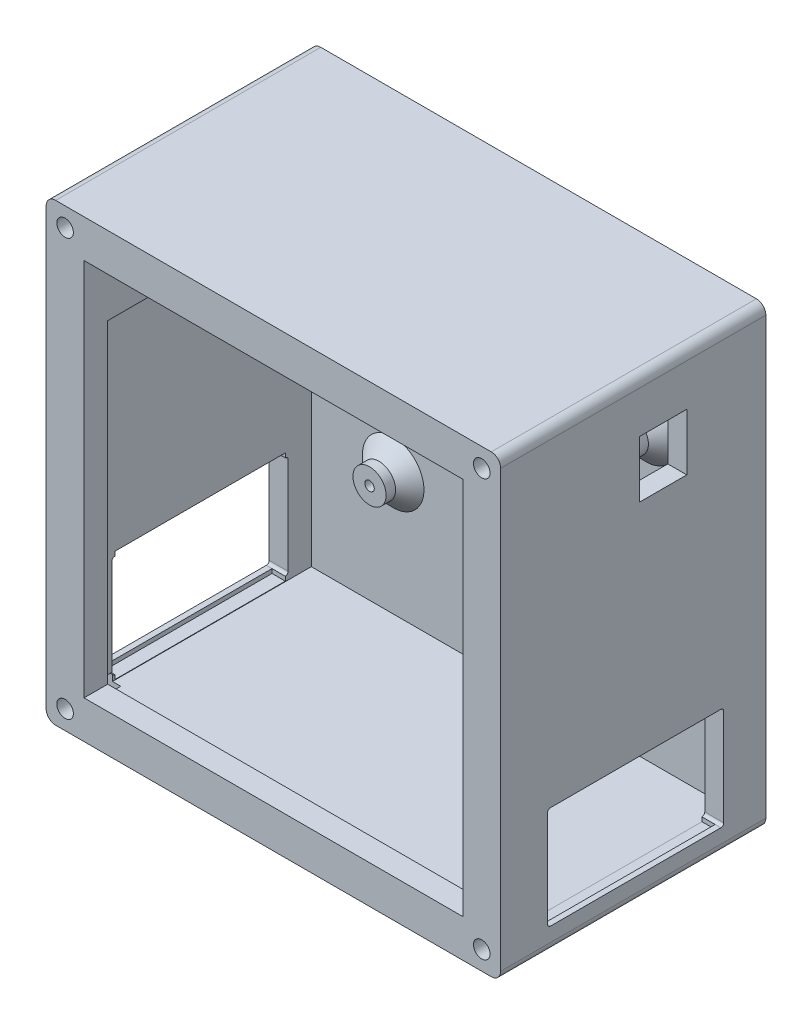
from build123d import *

# Parameters (mm, degrees)
SKETCH1_W           = 121.92
SKETCH1_H           = 121.92
SKETCH1_R           = 1.27
SKETCH1_R_2         = 0.889
BOSS_EXTRUDE1_DEPTH = 5.08
FILLET1_R           = 2.54
BOSS_EXTRUDE2_START = 59.69
SKETCH3_W           = 111.76
SKETCH3_H           = 111.76
BOSS_EXTRUDE2_DEPTH = 59.69
SKETCH11_R          = 4.064
SKETCH11_R_2        = 0.889
SKETCH11_R_3        = 4.445
SKETCH11_R_4        = 1.27
BOSS_EXTRUDE5_DEPTH = 6.35
CUT_EXTRUDE1_REACH  = 152.916
SKETCH6_W           = 45.72
SKETCH6_H           = 1.143
CUT_EXTRUDE2_DEPTH  = 3.556
BOSS_EXTRUDE4_START = 6.35
SKETCH10_W          = 101.6
SKETCH10_H          = 101.6
BOSS_EXTRUDE4_DEPTH = 6.35
CHAMFER1_SIZE       = 5.08
CHAMFER2_SIZE       = 3.81
CUT_EXTRUDE3_REACH  = 151.752
SKETCH13_W          = 12.7
SKETCH13_H          = 15.24
SKETCH16_W          = 35.56
SKETCH16_H          = 22.225
SKETCH16_W_2        = 5.08
BOSS_EXTRUDE6_DEPTH = 5.08
BOSS_EXTRUDE7_REACH = 135.14
SKETCH18_R          = 6.35
SKETCH18_R_2        = 1.651
CUT_EXTRUDE4_DEPTH  = 146.823432959
SKETCH19_R          = 2.2225
CUT_EXTRUDE5_DEPTH  = 12.7


with BuildPart() as part:
    # Sketch1 → Boss-Extrude1 (new body)
    with BuildSketch(Plane.XY):
        Rectangle(SKETCH1_W, SKETCH1_H)
        with Locations((-33.909, -22.9489)):
            Circle(SKETCH1_R, mode=Mode.SUBTRACT)
        with Locations((33.909, -22.9489)):
            Circle(SKETCH1_R, mode=Mode.SUBTRACT)
        with Locations(Location((33.909, 21.6281, 0), (0, 0, 180))):
            Circle(SKETCH1_R, mode=Mode.SUBTRACT)
        with Locations(Location((-33.909, 21.6281, 0), (0, 0, 180))):
            Circle(SKETCH1_R, mode=Mode.SUBTRACT)
        with Locations((-13.208, 26.6573)):
            Circle(SKETCH1_R_2, mode=Mode.SUBTRACT)
        with Locations((52.324, 26.6573)):
            Circle(SKETCH1_R_2, mode=Mode.SUBTRACT)
        with Locations(Location((52.324, 52.4383, 0), (0, 0, 180))):
            Circle(SKETCH1_R_2, mode=Mode.SUBTRACT)
        with Locations(Location((-13.208, 52.4383, 0), (0, 0, 180))):
            Circle(SKETCH1_R_2, mode=Mode.SUBTRACT)
    extrude(amount=BOSS_EXTRUDE1_DEPTH)

    # Fillet1
    fillet1_edges = [part.edges().sort_by_distance(p)[0] for p in [
        (60.96, -60.96, 2.54),
        (-60.96, -60.96, 2.54),
        (-60.96, 60.96, 2.54),
        (60.96, 60.96, 2.54),
    ]]
    fillet(fillet1_edges, radius=FILLET1_R)

    # Sketch3 → Boss-Extrude2 (add)
    with BuildSketch(Plane.XY.offset(5.08).offset(BOSS_EXTRUDE2_START)):
        with BuildLine():
            Line((58.42, 60.96), (-58.42, 60.96))
            ThreePointArc((-58.42, 60.96), (-60.216051224, 60.216051224), (-60.96, 58.42))
            Line((-60.96, 58.42), (-60.96, -58.42))
            ThreePointArc((-60.96, -58.42), (-60.216051224, -60.216051224), (-58.42, -60.96))
            Line((-58.42, -60.96), (58.42, -60.96))
            ThreePointArc((58.42, -60.96), (60.216051224, -60.216051224), (60.96, -58.42))
            Line((60.96, -58.42), (60.96, 58.42))
            ThreePointArc((60.96, 58.42), (60.216051224, 60.216051224), (58.42, 60.96))
        make_face()
        Rectangle(SKETCH3_W, SKETCH3_H, mode=Mode.SUBTRACT)
    extrude(amount=-BOSS_EXTRUDE2_DEPTH)

    # Sketch11 → Boss-Extrude5 (add)
    # profile 1 of 8: a face of its own
    with BuildSketch(Plane.XY.offset(5.08)):
        with Locations((52.324, 52.4383)):
            Circle(SKETCH11_R)
        with Locations(Location((52.324, 52.4383, 0), (0, 0, 180))):
            Circle(SKETCH11_R_2, mode=Mode.SUBTRACT)
    # profile 2 of 8: a face of its own
    with BuildSketch(Plane.XY.offset(5.08)):
        with Locations((52.324, 26.6573)):
            Circle(SKETCH11_R)
        with Locations((52.324, 26.6573)):
            Circle(SKETCH11_R_2, mode=Mode.SUBTRACT)
    # profile 3 of 8: a face of its own
    with BuildSketch(Plane.XY.offset(5.08)):
        with Locations(Location((33.909, 21.6281, 0), (0, 0, 180))):
            Circle(SKETCH11_R_3)
        with Locations(Location((33.909, 21.6281, 0), (0, 0, 180))):
            Circle(SKETCH11_R_4, mode=Mode.SUBTRACT)
    # profile 4 of 8: a face of its own
    with BuildSketch(Plane.XY.offset(5.08)):
        with Locations((-13.208, 52.4383)):
            Circle(SKETCH11_R)
        with Locations(Location((-13.208, 52.4383, 0), (0, 0, 180))):
            Circle(SKETCH11_R_2, mode=Mode.SUBTRACT)
    # profile 5 of 8: a face of its own
    with BuildSketch(Plane.XY.offset(5.08)):
        with Locations(Location((-13.208, 26.6573, 0), (0, 0, 180))):
            Circle(SKETCH11_R)
        with Locations((-13.208, 26.6573)):
            Circle(SKETCH11_R_2, mode=Mode.SUBTRACT)
    # profile 6 of 8: a face of its own
    with BuildSketch(Plane.XY.offset(5.08)):
        with Locations(Location((-33.909, -22.9489, 0), (0, 0, 180))):
            Circle(SKETCH11_R_3)
        with Locations((-33.909, -22.9489)):
            Circle(SKETCH11_R_4, mode=Mode.SUBTRACT)
    # profile 7 of 8: a face of its own
    with BuildSketch(Plane.XY.offset(5.08)):
        with Locations(Location((-33.909, 21.6281, 0), (0, 0, 180))):
            Circle(SKETCH11_R_3)
        with Locations(Location((-33.909, 21.6281, 0), (0, 0, 180))):
            Circle(SKETCH11_R_4, mode=Mode.SUBTRACT)
    # profile 8 of 8: a face of its own
    with BuildSketch(Plane.XY.offset(5.08)):
        with Locations(Location((33.909, -22.9489, 0), (0, 0, 180))):
            Circle(SKETCH11_R_3)
        with Locations((33.909, -22.9489)):
            Circle(SKETCH11_R_4, mode=Mode.SUBTRACT)
    extrude(amount=BOSS_EXTRUDE5_DEPTH)

    # Sketch5 → Cut-Extrude1 (cut, up to next)
    with BuildSketch(Plane(origin=(60.96, 0, 0), x_dir=(0, 0, -1), z_dir=(1, 0, 0)), mode=Mode.PRIVATE) as cut_extrude1_sk1:
        with BuildLine():
            Line((-12.065, -54.61), (-57.785, -54.61))
            ThreePointArc((-57.785, -54.61), (-58.323815367, -54.386815367), (-58.547, -53.848))
            Line((-58.547, -53.848), (-58.547, -27.8638))
            ThreePointArc((-58.547, -27.8638), (-58.323815367, -27.324984633), (-57.785, -27.1018))
            Line((-57.785, -27.1018), (-12.065, -27.1018))
            ThreePointArc((-12.065, -27.1018), (-11.526184633, -27.324984633), (-11.303, -27.8638))
            Line((-11.303, -27.8638), (-11.303, -53.848))
            ThreePointArc((-11.303, -53.848), (-11.526184633, -54.386815367), (-12.065, -54.61))
        make_face()
    cut_extrude1_tool1 = extrude(cut_extrude1_sk1.sketch, amount=-CUT_EXTRUDE1_REACH, mode=Mode.PRIVATE) & part.part
    cut_extrude1 = cut_extrude1_tool1.solids().sort_by_distance((60.96, -40.8559, 34.925))[0]
    add(cut_extrude1, mode=Mode.SUBTRACT)

    # Sketch6 → Cut-Extrude2 (cut)
    with BuildSketch(Plane.ZY.offset(-55.88)):
        with Locations((34.925, -55.1815)):
            Rectangle(SKETCH6_W, SKETCH6_H)
        with Locations((34.925, -26.5303)):
            Rectangle(SKETCH6_W, SKETCH6_H)
    cut_extrude2 = extrude(amount=-CUT_EXTRUDE2_DEPTH, mode=Mode.SUBTRACT)

    # Mirror2: Cut-Extrude1, Cut-Extrude2 across plane
    add(cut_extrude1.mirror(Plane(origin=(0, 0, 0), x_dir=(0, 0, 1), z_dir=(1, 0, 0))), mode=Mode.SUBTRACT)
    add(cut_extrude2.mirror(Plane(origin=(0, 0, 0), x_dir=(0, 0, 1), z_dir=(1, 0, 0))), mode=Mode.SUBTRACT)

    # Sketch10 → Boss-Extrude4 (add)
    with BuildSketch(Plane.XY.offset(64.77).offset(BOSS_EXTRUDE4_START)):
        with BuildLine():
            Line((58.42, 60.96), (-58.42, 60.96))
            ThreePointArc((-58.42, 60.96), (-60.216051224, 60.216051224), (-60.96, 58.42))
            Line((-60.96, 58.42), (-60.96, -58.42))
            ThreePointArc((-60.96, -58.42), (-60.216051224, -60.216051224), (-58.42, -60.96))
            Line((-58.42, -60.96), (58.42, -60.96))
            ThreePointArc((58.42, -60.96), (60.216051224, -60.216051224), (60.96, -58.42))
            Line((60.96, -58.42), (60.96, 58.42))
            ThreePointArc((60.96, 58.42), (60.216051224, 60.216051224), (58.42, 60.96))
        make_face()
        Rectangle(SKETCH10_W, SKETCH10_H, mode=Mode.SUBTRACT)
    extrude(amount=-BOSS_EXTRUDE4_DEPTH)

    # Chamfer1
    chamfer1_edges = [part.edges().sort_by_distance(p)[0] for p in [
        (55.88, 0, 64.77),
        (0, 55.88, 64.77),
        (-55.88, 0, 64.77),
        (0, -55.88, 64.77),
    ]]
    chamfer(chamfer1_edges, length=CHAMFER1_SIZE - 0.0001)  # a hair under: the kernel refuses the full size

    # Chamfer2
    chamfer2_edges = [part.edges().sort_by_distance(p)[0] for p in [
        (49.530944347, 49.486192936, 5.08),
        (48.26, 26.6573, 5.08),
        (38.354, 21.6281, 5.08),
        (-13.208, 48.3743, 5.08),
        (-9.144, 26.6573, 5.08),
        (-29.464, -22.9489, 5.08),
        (-29.464, 21.6281, 5.08),
        (38.354, -22.9489, 5.08),
    ]]
    chamfer(chamfer2_edges, length=CHAMFER2_SIZE)

    # Sketch13 → Cut-Extrude3 (cut, up to next)
    with BuildSketch(Plane.ZY.offset(-55.88), mode=Mode.PRIVATE) as cut_extrude3_sk1:
        with Locations((27.559, 39.5478)):
            Rectangle(SKETCH13_W, SKETCH13_H)
    cut_extrude3_tool1 = extrude(cut_extrude3_sk1.sketch, amount=-CUT_EXTRUDE3_REACH, mode=Mode.PRIVATE) & part.part
    add(cut_extrude3_tool1.solids().sort_by_distance((55.88, 39.5478, 27.559))[0], mode=Mode.SUBTRACT)

    # Sketch16 → Boss-Extrude6 (add)
    with BuildSketch(Plane(origin=(-55.88, 0, 0), x_dir=(0, 0, -1), z_dir=(1, 0, 0))):
        with Locations((-41.91, 44.7675)):
            Rectangle(SKETCH16_W, SKETCH16_H)
        with Locations((-62.23, 44.7675)):
            Rectangle(SKETCH16_W_2, SKETCH16_H)
    extrude(amount=BOSS_EXTRUDE6_DEPTH)

    # Sketch17 → Boss-Extrude7 (add, up to next)
    with BuildSketch(Plane.XZ.offset(-33.655), mode=Mode.PRIVATE) as boss_extrude7_sk1:
        Polygon((-55.88, 24.13), (-55.88, 19.05), (-50.8, 24.13), align=None)
    boss_extrude7_tool1 = extrude(boss_extrude7_sk1.sketch, amount=-BOSS_EXTRUDE7_REACH, mode=Mode.PRIVATE) - part.part
    add(boss_extrude7_tool1.solids().sort_by_distance((-54.186667, 33.655, 22.436667))[0])

    # Sketch18 → Cut-Extrude4 (cut, through all)
    with BuildSketch(Plane(origin=(-50.8, 0, 0), x_dir=(0, 0, -1), z_dir=(1, 0, 0))):
        with Locations((-41.91, 44.7675)):
            Circle(SKETCH18_R)
        with Locations((-54.61, 44.7675)):
            Circle(SKETCH18_R_2)
        with Locations((-29.21, 44.7675)):
            Circle(SKETCH18_R_2)
    extrude(amount=-CUT_EXTRUDE4_DEPTH, mode=Mode.SUBTRACT)

    # Sketch19 → Cut-Extrude5 (cut)
    with BuildSketch(Plane.XY.offset(71.12)):
        with Locations((-55.88, -55.88)):
            Circle(SKETCH19_R)
        with Locations((-55.88, 55.88)):
            Circle(SKETCH19_R)
        with Locations((55.88, 55.88)):
            Circle(SKETCH19_R)
        with Locations((55.88, -55.88)):
            Circle(SKETCH19_R)
    extrude(amount=-CUT_EXTRUDE5_DEPTH, mode=Mode.SUBTRACT)


solid = part.part
